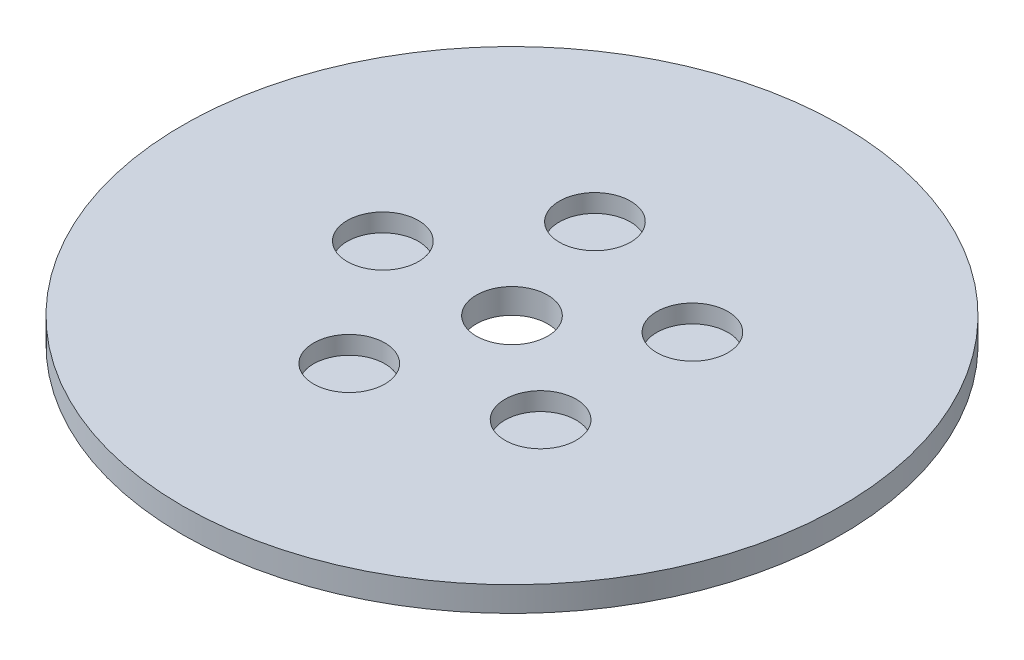
from build123d import *

# Parameters (mm, degrees)
SKETCH1_R           = 92.5
BOSS_EXTRUDE1_DEPTH = 7
SKETCH2_R           = 10
CUT_EXTRUDE1_DEPTH  = 132.001908383
SKETCH3_R           = 10
CUT_EXTRUDE2_DEPTH  = 5.079365094
CIRPATTERN1_COUNT   = 5


with BuildPart() as part:
    # Sketch1 → Boss-Extrude1 (new body)
    with BuildSketch(Plane(origin=(0, 0, 0), x_dir=(1, 0, 0), z_dir=(0, 1, 0))):
        Circle(SKETCH1_R)
    extrude(amount=BOSS_EXTRUDE1_DEPTH)

    # Sketch2 → Cut-Extrude1 (cut, through all)
    with BuildSketch(Plane(origin=(0, 0, 0), x_dir=(1, 0, 0), z_dir=(0, 1, 0))):
        Circle(SKETCH2_R)
    extrude(amount=CUT_EXTRUDE1_DEPTH, mode=Mode.SUBTRACT)

    # Sketch3 → Cut-Extrude2 (cut)
    with BuildSketch(Plane(origin=(0, 7, 0), x_dir=(1, 0, 0), z_dir=(0, 1, 0))):
        with Locations((-36.249645253, 0)):
            Circle(SKETCH3_R)
    cut_extrude2 = extrude(amount=-CUT_EXTRUDE2_DEPTH, mode=Mode.SUBTRACT)

    # CirPattern1: Cut-Extrude2 ×5 about axis
    cirpattern1_axis = Axis((0, 0, 0), (0, 1, 0))
    for i in range(1, CIRPATTERN1_COUNT):
        add(cut_extrude2.rotate(cirpattern1_axis, i * 360 / CIRPATTERN1_COUNT), mode=Mode.SUBTRACT)


solid = part.part
